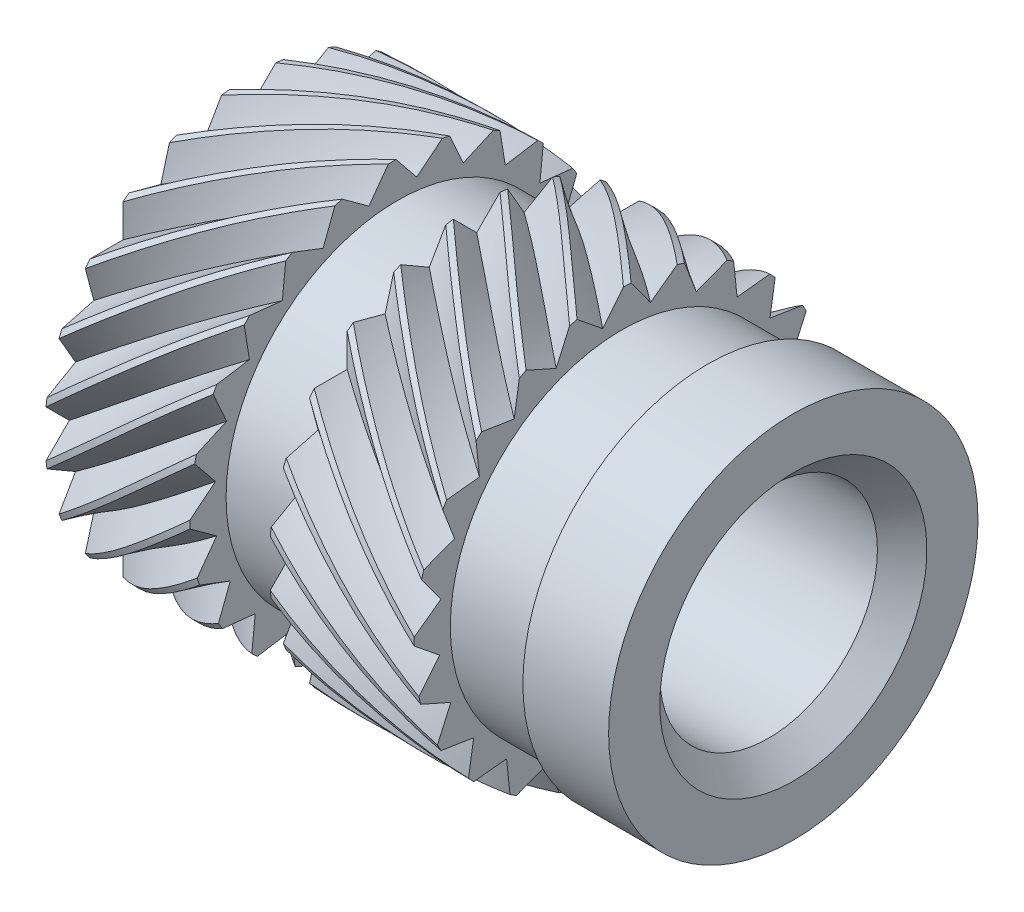
from build123d import *

# Parameters (mm, degrees)
SWEEP_1_PITCH            = 22
SWEEP_2_PITCH            = 22
PATTERN_CIRCULAR_1_COUNT = 24


with BuildPart() as part:
    # Эскиз1 → Повернуть1 (revolve)
    with BuildSketch(Plane.XY, mode=Mode.PRIVATE) as revolve_1_sk:
        Polygon((0, 1.5), (0, 3.15), (2.2, 3.15), (2.2, 2.6), (3.4, 2.6), (3.4, 3.15), (5.6, 3.15), (5.6, 2.6), (6.9, 2.6), (6.9, 2.8), (8.2, 2.8), (8.2, 1.5), align=None)
    revolve(revolve_1_sk.sketch.rotate(Axis((0, 0, 0), (1, 0, 0)), 90), axis=Axis((0, 0, 0), (1, 0, 0)))

    # Эскиз2 → Отверстие обработанное метчиком M41 (revolve, cut)
    with BuildSketch(Plane.ZX):
        Polygon((0, 0), (0, 8.2), (2.025, 8.2), (1.65, 7.825), (1.65, 0.375), (2.025, 0), align=None)
    revolve(axis=Axis((-6.35, 0, 0), (1, 0, 0)), mode=Mode.SUBTRACT)

    # Вырез-По траектории1: the profile of Эскиз5 screwed along a left-hand helix of 0.13 turns, 20 arcs to a turn; built about Z, then put on its axis
    sweep_1_z = Axis((0, 0, 0), (0, 0, 1))
    sweep_1_corners = [(3.130095845, -0.353553391, 0), (2.776542455, 0, 0), (3.130095845, 0.353553391, 0)]
    with BuildLine(mode=Mode.PRIVATE) as sweep_1_profile:
        Line(sweep_1_corners[0], sweep_1_corners[1])
        Line(sweep_1_corners[1], sweep_1_corners[2])
        ThreePointArc((3.130095845, 0.353553391, 0), (3.15, 0, 0), (3.130095845, -0.353553391, 0))
    sweep_1_cap = Face(sweep_1_profile.wire())
    sweep_1_arcs = [((3.130095845, 0.353553391, 0), (3.170030725, 0, 0), (3.130095845, -0.353553391, 0), (1, 0.9936812206913996, 1))]  # start, shoulder, end, weights
    sweep_1_turn_angles = [0, -9, -18, -27, -36, -41.4, -46.8]
    sweep_1_turn_weights = [1, 0.9876883405951378, 1, 0.9876883405951378, 1, 0.9955619646030799, 1]
    sweep_1_turn_rails = [Edge.make_bspline([Vector(p[0], p[1], 0).rotate(sweep_1_z, sweep_1_turn_angles[k]) / sweep_1_turn_weights[k] + Vector(0, 0, p[2] + -SWEEP_1_PITCH * sweep_1_turn_angles[k] / 360) for k in range(7)], [0, 0, 0, 1, 1, 2, 2, 3, 3, 3], 2, sweep_1_turn_weights) for p in sweep_1_corners]
    sweep_1_turn_sides = [*[Face.make_surface_from_curves(sweep_1_turn_rails[p[0]], sweep_1_turn_rails[p[1]]) for p in [(0, 1), (1, 2)]], *[Face.make_bezier_surface([[Vector(p[j][0], p[j][1], 0).rotate(sweep_1_z, sweep_1_turn_angles[2 * i + k]) / sweep_1_turn_weights[2 * i + k] + Vector(0, 0, p[j][2] + -SWEEP_1_PITCH * sweep_1_turn_angles[2 * i + k] / 360) for k in range(3)] for j in range(3)], [[p[3][j] * sweep_1_turn_weights[2 * i + k] for k in range(3)] for j in range(3)]) for p in sweep_1_arcs for i in range(3)]]
    sweep_1 = Plane(origin=(0, 0, 0), x_dir=(0, 0, 1), z_dir=(1, 0, 0)) * Solid(Shell([*sweep_1_turn_sides, sweep_1_cap, sweep_1_cap.rotate(sweep_1_z, -46.8).moved(Location((0, 0, -SWEEP_1_PITCH * -46.8 / 360)))]))
    add(sweep_1, mode=Mode.SUBTRACT)

    # Вырез-По траектории2: the profile of Эскиз7 screwed along a right-hand helix of 0.13 turns, 20 arcs to a turn; built about Z, then put on its axis
    sweep_2_z = Axis((0, 0, 0), (0, 0, 1))
    sweep_2_corners = [(3.130095845, -0.353553391, 0), (2.776542455, 0, 0), (3.130095845, 0.353553391, 0)]
    with BuildLine(mode=Mode.PRIVATE) as sweep_2_profile:
        Line(sweep_2_corners[0], sweep_2_corners[1])
        Line(sweep_2_corners[1], sweep_2_corners[2])
        ThreePointArc((3.130095845, 0.353553391, 0), (3.15, 0, 0), (3.130095845, -0.353553391, 0))
    sweep_2_cap = Face(sweep_2_profile.wire())
    sweep_2_arcs = [((3.130095845, 0.353553391, 0), (3.170030725, 0, 0), (3.130095845, -0.353553391, 0), (1, 0.9936812206913996, 1))]  # start, shoulder, end, weights
    sweep_2_turn_angles = [0, 9, 18, 27, 36, 41.4, 46.8]
    sweep_2_turn_weights = [1, 0.9876883405951378, 1, 0.9876883405951378, 1, 0.9955619646030799, 1]
    sweep_2_turn_rails = [Edge.make_bspline([Vector(p[0], p[1], 0).rotate(sweep_2_z, sweep_2_turn_angles[k]) / sweep_2_turn_weights[k] + Vector(0, 0, p[2] + SWEEP_2_PITCH * sweep_2_turn_angles[k] / 360) for k in range(7)], [0, 0, 0, 1, 1, 2, 2, 3, 3, 3], 2, sweep_2_turn_weights) for p in sweep_2_corners]
    sweep_2_turn_sides = [*[Face.make_surface_from_curves(sweep_2_turn_rails[p[0]], sweep_2_turn_rails[p[1]]) for p in [(0, 1), (1, 2)]], *[Face.make_bezier_surface([[Vector(p[j][0], p[j][1], 0).rotate(sweep_2_z, sweep_2_turn_angles[2 * i + k]) / sweep_2_turn_weights[2 * i + k] + Vector(0, 0, p[j][2] + SWEEP_2_PITCH * sweep_2_turn_angles[2 * i + k] / 360) for k in range(3)] for j in range(3)], [[p[3][j] * sweep_2_turn_weights[2 * i + k] for k in range(3)] for j in range(3)]) for p in sweep_2_arcs for i in range(3)]]
    sweep_2 = Plane(origin=(3.4, 0, 0), x_dir=(0, 0, 1), z_dir=(1, 0, 0)) * Solid(Shell([*sweep_2_turn_sides, sweep_2_cap, sweep_2_cap.rotate(sweep_2_z, 46.8).moved(Location((0, 0, SWEEP_2_PITCH * 46.8 / 360)))]))
    add(sweep_2, mode=Mode.SUBTRACT)

    # Круговой массив1: Вырез-По траектории1, Вырез-По траектории2 ×24 about axis
    pattern_circular_1_axis = Axis((0, 0, 0), (-1, 0, 0))
    add([sweep_1.rotate(pattern_circular_1_axis, i * 360 / PATTERN_CIRCULAR_1_COUNT) for i in range(1, PATTERN_CIRCULAR_1_COUNT)], mode=Mode.SUBTRACT)
    add([sweep_2.rotate(pattern_circular_1_axis, i * 360 / PATTERN_CIRCULAR_1_COUNT) for i in range(1, PATTERN_CIRCULAR_1_COUNT)], mode=Mode.SUBTRACT)


solid = part.part
